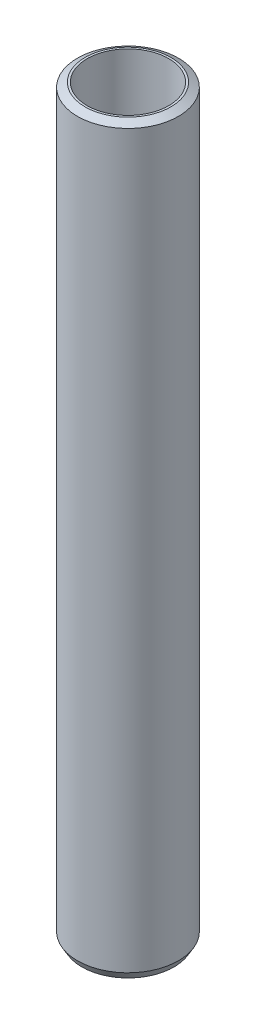
from build123d import *
from OCP.BRepFilletAPI import BRepFilletAPI_MakeChamfer

# Parameters (mm, degrees)
SKETCH1_R           = 22.5
BOSS_EXTRUDE1_DEPTH = 331.143968957
SKETCH2_R           = 18.178115358
CUT_EXTRUDE1_DEPTH  = 333.669247417
CHAMFER1_SIZE       = 1.959163337
CHAMFER1_SIZE2      = 3.39337044


with BuildPart() as part:
    # Sketch1 → Boss-Extrude1 (new body)
    with BuildSketch(Plane(origin=(0, 0, 0), x_dir=(1, 0, 0), z_dir=(0, 1, 0))):
        Circle(SKETCH1_R)
    extrude(amount=BOSS_EXTRUDE1_DEPTH)

    # Sketch2 → Cut-Extrude1 (cut, through all)
    with BuildSketch(Plane(origin=(0, 0, 0), x_dir=(1, 0, 0), z_dir=(0, 1, 0))):
        Circle(SKETCH2_R)
    extrude(amount=CUT_EXTRUDE1_DEPTH, mode=Mode.SUBTRACT)

    # Chamfer1: one chamfer whose edges measure the first distance from different faces: ONE call of the kernel's chamfer builder (chamfer() names one face for all edges)
    chamfer1_edges_1 = [part.edges().sort_by_distance(p)[0] for p in [
        (-22.5, 331.143968957, 0),
    ]]
    chamfer1_side_1 = [part.faces().sort_by_distance(p)[0] for p in [
        (-22.5, 165.571984479, 0),
    ]]
    chamfer1_edges_2 = [part.edges().sort_by_distance(p)[0] for p in [
        (-22.5, 0, 0),
    ]]
    chamfer1_side_2 = [part.faces().sort_by_distance(p)[0] for p in [
        (-21.863603897, 0, 0),
    ]]
    chamfer1 = BRepFilletAPI_MakeChamfer(part.part.solid().wrapped)
    for e in chamfer1_edges_1:
        chamfer1.Add(CHAMFER1_SIZE, CHAMFER1_SIZE2, e.wrapped, chamfer1_side_1[0].wrapped)  # the first distance lies on this face
    for e in chamfer1_edges_2:
        chamfer1.Add(CHAMFER1_SIZE, CHAMFER1_SIZE2, e.wrapped, chamfer1_side_2[0].wrapped)  # the first distance lies on this face
    add(Compound.cast(chamfer1.Shape()), mode=Mode.REPLACE)


solid = part.part
